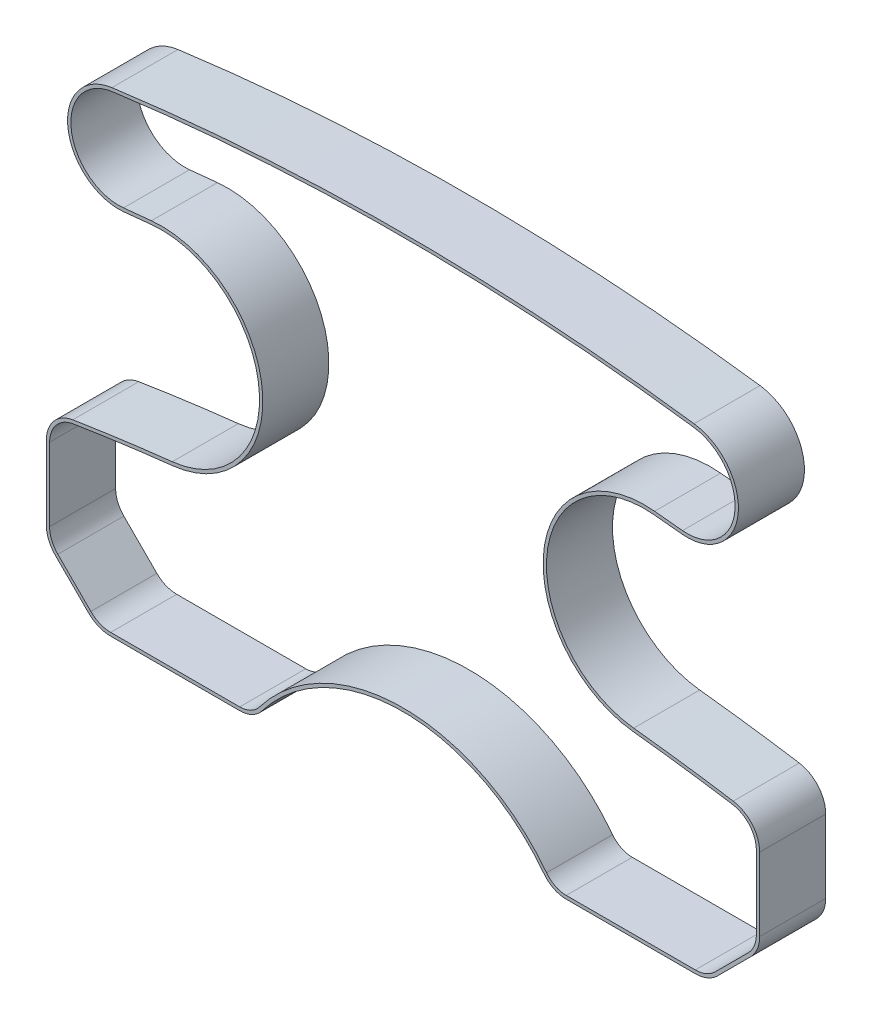
from build123d import *

# Parameters (mm, degrees)
BOSS_EXTRUDE1_DEPTH = 20


with BuildPart() as part:
    # Sketch1 → Boss-Extrude1 (new body)
    with BuildSketch(Plane.XY):
        with BuildLine():
            ThreePointArc((-95.258115191, -66.717514421), (-92.176093377, -68.776855559), (-88.540600769, -69.5))
            Line((-88.540600769, -69.5), (-49.448515829, -69.5))
            ThreePointArc((-49.448515829, -69.5), (-45.674858764, -68.616397597), (-42.685769334, -66.149297024))
            ThreePointArc((-42.685769334, -66.149297024), (0, -45), (42.685769334, -66.149297024))
            ThreePointArc((42.685769334, -66.149297024), (45.674858764, -68.616397597), (49.448515829, -69.5))
            Line((49.448515829, -69.5), (88.540600769, -69.5))
            ThreePointArc((88.540600769, -69.5), (92.176093377, -68.776855559), (95.258115191, -66.717514421))
            Line((95.258115191, -66.717514421), (105.258115191, -56.717514421))
            ThreePointArc((105.258115191, -56.717514421), (107.317456328, -53.635492607), (108.040600769, -50))
            Line((108.040600769, -50), (108.040600769, -27.862546721))
            ThreePointArc((108.040600769, -27.862546721), (105.768299668, -21.697291769), (100.038417901, -18.48136642))
            ThreePointArc((100.038417901, -18.48136642), (84.982869439, -16.262381096), (69.878433865, -14.40510854))
            ThreePointArc((69.878433865, -14.40510854), (43.620166441, 18.220082042), (76.105927487, 44.650651425))
            Line((76.105927487, 44.650651425), (84.550645906, 43.805313077))
            ThreePointArc((84.550645906, 43.805313077), (101.4888683, 57.421563727), (88.163458495, 74.589531375))
            ThreePointArc((88.163458495, 74.589531375), (0, 80.5), (-88.163458495, 74.589531375))
            ThreePointArc((-88.163458495, 74.589531375), (-101.4888683, 57.421563727), (-84.550645906, 43.805313077))
            Line((-84.550645906, 43.805313077), (-76.105927487, 44.650651425))
            ThreePointArc((-76.105927487, 44.650651425), (-43.620166441, 18.220082042), (-69.878433865, -14.40510854))
            ThreePointArc((-69.878433865, -14.40510854), (-84.982869439, -16.262381096), (-100.038417901, -18.48136642))
            ThreePointArc((-100.038417901, -18.48136642), (-105.768299668, -21.697291769), (-108.040600769, -27.862546721))
            Line((-108.040600769, -27.862546721), (-108.040600769, -50))
            ThreePointArc((-108.040600769, -50), (-107.317456328, -53.635492607), (-105.258115191, -56.717514421))
            Line((-105.258115191, -56.717514421), (-95.258115191, -66.717514421))
        make_face()
        with BuildLine():
            Line((88.540600769, -68.5), (49.448515829, -68.5))
            ThreePointArc((49.448515829, -68.5), (46.118818418, -67.720350821), (43.481386569, -65.543497375))
            ThreePointArc((43.481386569, -65.543497375), (0, -44), (-43.481386569, -65.543497375))
            ThreePointArc((-43.481386569, -65.543497375), (-46.118818418, -67.720350821), (-49.448515829, -68.5))
            Line((-49.448515829, -68.5), (-88.540600769, -68.5))
            ThreePointArc((-88.540600769, -68.5), (-91.793409945, -67.852976026), (-94.55100841, -66.01040764))
            Line((-94.55100841, -66.01040764), (-104.55100841, -56.01040764))
            ThreePointArc((-104.55100841, -56.01040764), (-106.393576796, -53.252809175), (-107.040600769, -50))
            Line((-107.040600769, -50), (-107.040600769, -27.862546721))
            ThreePointArc((-107.040600769, -27.862546721), (-105.007489258, -22.346265975), (-99.88075294, -19.468859084))
            ThreePointArc((-99.88075294, -19.468859084), (-84.848932687, -17.253370978), (-69.768302369, -15.399025565))
            ThreePointArc((-69.768302369, -15.399025565), (-42.625680462, 18.324951662), (-76.205532294, 45.645678501))
            Line((-76.205532294, 45.645678501), (-84.650250712, 44.800340153))
            ThreePointArc((-84.650250712, 44.800340153), (-100.495684565, 57.538123019), (-88.029978619, 73.598479852))
            ThreePointArc((-88.029978619, 73.598479852), (0, 79.5), (88.029978619, 73.598479852))
            ThreePointArc((88.029978619, 73.598479852), (100.495684565, 57.538123019), (84.650250712, 44.800340153))
            Line((84.650250712, 44.800340153), (76.205532294, 45.645678501))
            ThreePointArc((76.205532294, 45.645678501), (42.625680462, 18.324951662), (69.768302369, -15.399025565))
            ThreePointArc((69.768302369, -15.399025565), (84.848932687, -17.253370978), (99.88075294, -19.468859084))
            ThreePointArc((99.88075294, -19.468859084), (105.007489258, -22.346265975), (107.040600769, -27.862546721))
            Line((107.040600769, -27.862546721), (107.040600769, -50))
            ThreePointArc((107.040600769, -50), (106.393576796, -53.252809175), (104.55100841, -56.01040764))
            Line((104.55100841, -56.01040764), (94.55100841, -66.01040764))
            ThreePointArc((94.55100841, -66.01040764), (91.793409945, -67.852976026), (88.540600769, -68.5))
        make_face(mode=Mode.SUBTRACT)
    extrude(amount=BOSS_EXTRUDE1_DEPTH)


solid = part.part
